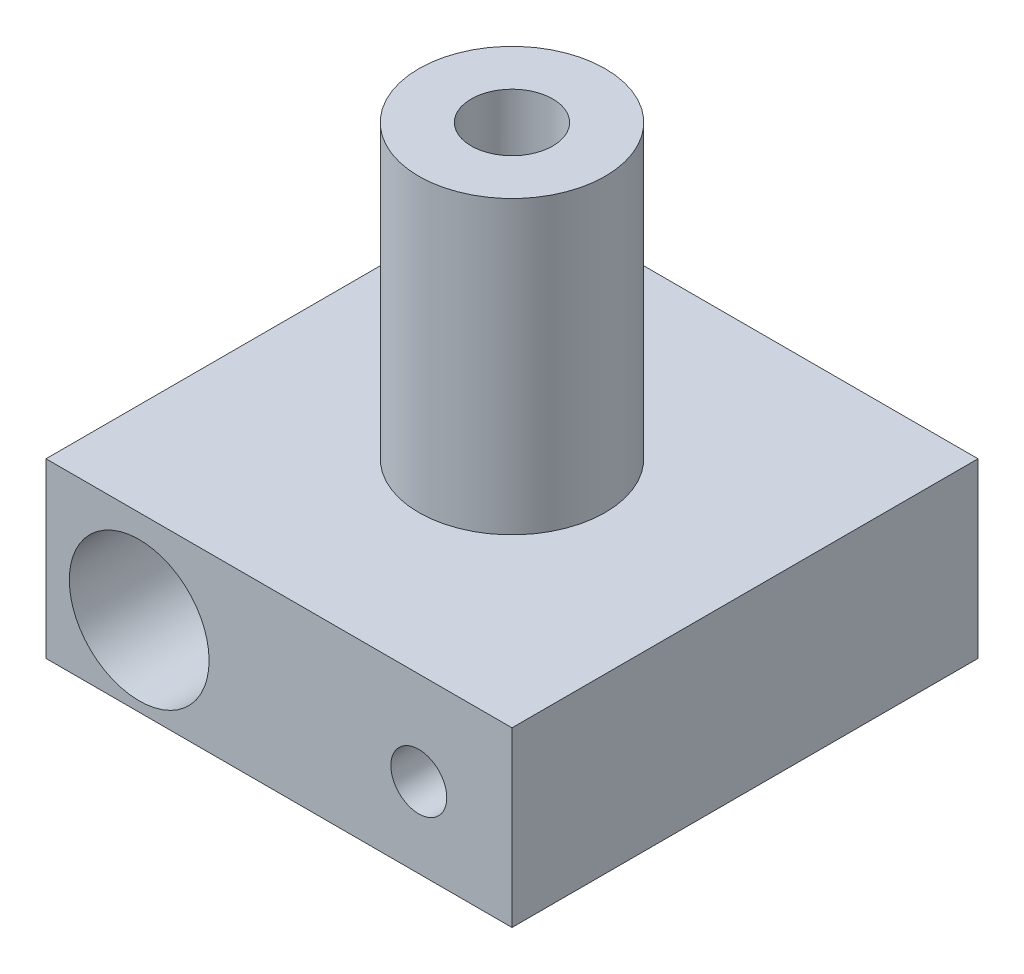
from build123d import *
from build123d.topology import SkipClean

# Parameters (mm, degrees)
SCHIZZO2_W                          = 20
SCHIZZO2_H                          = 20
SCHIZZO2_R                          = 0.15
ESTRUSIONE_ESTRUSIONE1_DEPTH        = 8
ESTRUSIONE_SOTTILE1_START           = 12.5
SCHIZZO3_R                          = 4
SCHIZZO3_R_2                        = 1.75
ESTRUSIONE_SOTTILE1_DEPTH           = 12.5
TAGLIO_ESTRUSIONE1_REACH            = 32.336
SCHIZZO4_R                          = 3
SCHIZZO4_R_2                        = 1.2
FORO_FILETTATO_M6X1_0_1_D           = 5
FORO_FILETTATO_M6X1_0_1_DEPTH       = 12
FORO_FILETTATO_M6X1_0_1_CSINK_D     = 6.05
FORO_FILETTATO_M6X1_0_1_CSINK_ANGLE = 90
FORO_FILETTATO_M6X1_0_1_TIP         = 1.502151548
SMUSSO1_SIZE                        = 1
SMUSSO1_SIZE2                       = 0.577350269


with BuildPart() as part:
    # Schizzo1 → Rivoluzione1 (revolve)
    with BuildSketch(Plane.XY):
        Polygon((-0.15, 0), (-0.15, -4), (-0.5, -4), (-4, -1.5), (-4, 0), align=None)
    revolve(axis=Axis((0, -26.528171736, 0), (0, 1, 0)))

    # Schizzo2 → Estrusione-Estrusione1 (add)
    with BuildSketch(Plane(origin=(0, 0, 0), x_dir=(1, 0, 0), z_dir=(0, 1, 0))):
        Rectangle(SCHIZZO2_W, SCHIZZO2_H)
        Circle(SCHIZZO2_R, mode=Mode.SUBTRACT)
    extrude(amount=ESTRUSIONE_ESTRUSIONE1_DEPTH)

    # Schizzo3 → Estrusione-Sottile1 (add)
    with SkipClean():  # the faces are left unmerged after this step: merging them gives an invalid solid
        with BuildSketch(Plane(origin=(0, 8, 0), x_dir=(1, 0, 0), z_dir=(0, 1, 0)).offset(ESTRUSIONE_SOTTILE1_START)):
            Circle(SCHIZZO3_R)
            Circle(SCHIZZO3_R_2, mode=Mode.SUBTRACT)
        extrude(amount=-ESTRUSIONE_SOTTILE1_DEPTH)
    add(part.part.scale(1), mode=Mode.REPLACE)  # the faces are merged on a copy

    # Schizzo4 → Taglio-Estrusione1 (cut, up to next)
    with BuildSketch(Plane.XY.offset(10), mode=Mode.PRIVATE) as taglio_estrusione1_sk1:
        with Locations((-6, 4)):
            Circle(SCHIZZO4_R)
    taglio_estrusione1_tool1 = extrude(taglio_estrusione1_sk1.sketch, amount=-TAGLIO_ESTRUSIONE1_REACH, mode=Mode.PRIVATE) & part.part
    # Schizzo4 → Taglio-Estrusione1 (cut, up to next)
    with BuildSketch(Plane.XY.offset(10), mode=Mode.PRIVATE) as taglio_estrusione1_sk2:
        with Locations((6, 4)):
            Circle(SCHIZZO4_R_2)
    taglio_estrusione1_tool2 = extrude(taglio_estrusione1_sk2.sketch, amount=-TAGLIO_ESTRUSIONE1_REACH, mode=Mode.PRIVATE) & part.part
    add(taglio_estrusione1_tool1.solids().sort_by_distance((-6, 4, 10))[0], mode=Mode.SUBTRACT)
    add(taglio_estrusione1_tool2.solids().sort_by_distance((6, 4, 10))[0], mode=Mode.SUBTRACT)

    # Foro filettato M6x1.0-1
    with Locations(Plane(origin=(0, 0, -10), x_dir=(-1, 0, 0), z_dir=(0, 0, -1))):
        with Locations((-6, 4)):
            CounterSinkHole(FORO_FILETTATO_M6X1_0_1_D / 2, FORO_FILETTATO_M6X1_0_1_CSINK_D / 2, depth=FORO_FILETTATO_M6X1_0_1_DEPTH, counter_sink_angle=FORO_FILETTATO_M6X1_0_1_CSINK_ANGLE)
            with Locations((0, 0, -(FORO_FILETTATO_M6X1_0_1_DEPTH + FORO_FILETTATO_M6X1_0_1_TIP / 2))):  # 118° drill point
                Cone(0, FORO_FILETTATO_M6X1_0_1_D / 2, FORO_FILETTATO_M6X1_0_1_TIP, mode=Mode.SUBTRACT)

    # Smusso1
    smusso1_edges = [part.edges().sort_by_distance(p)[0] for p in [
        (0, 0, 10),
        (10, 0, 0),
        (0, 0, -10),
        (-10, 0, 0),
    ]]
    smusso1_side = [part.faces().sort_by_distance(p)[0] for p in [
        (0, 0, 9.717157288),
    ]]
    chamfer(smusso1_edges, length=SMUSSO1_SIZE, length2=SMUSSO1_SIZE2, reference=smusso1_side[0])


solid = part.part
